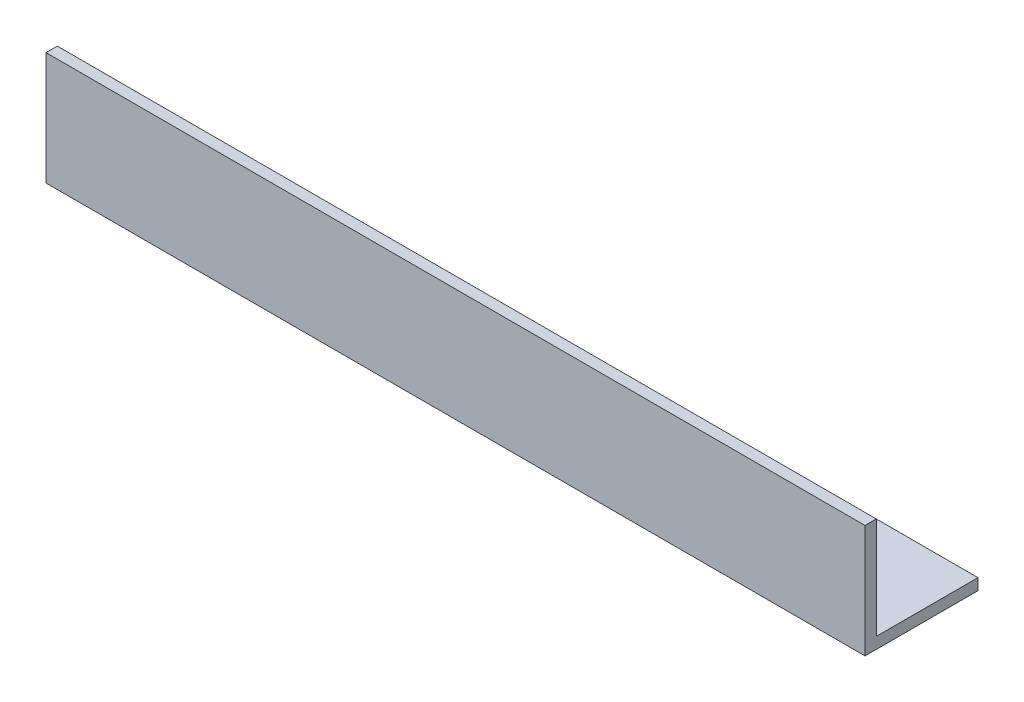
from build123d import *

# Parameters (mm, degrees)
BOSS_EXTRUDE1_DEPTH = 145
SKETCH2_R           = 2.5
CUT_EXTRUDE1_DEPTH  = 2


with BuildPart() as part:
    # Sketch1 → Boss-Extrude1 (new body)
    with BuildSketch(Plane(origin=(0, 0, 0), x_dir=(0, 0, -1), z_dir=(1, 0, 0))):
        Polygon((0, 20), (0, 0), (20, 0), (20, 2), (2, 2), (2, 20), align=None)
    extrude(amount=BOSS_EXTRUDE1_DEPTH)

    # Sketch2 → Cut-Extrude1 (cut)
    with BuildSketch(Plane(origin=(0, 2, 0), x_dir=(1, 0, 0), z_dir=(0, 1, 0))):
        with Locations((8, 11)):
            Circle(SKETCH2_R)
        with Locations((40, 11)):
            Circle(SKETCH2_R)
    extrude(amount=-CUT_EXTRUDE1_DEPTH, mode=Mode.SUBTRACT)


solid = part.part
